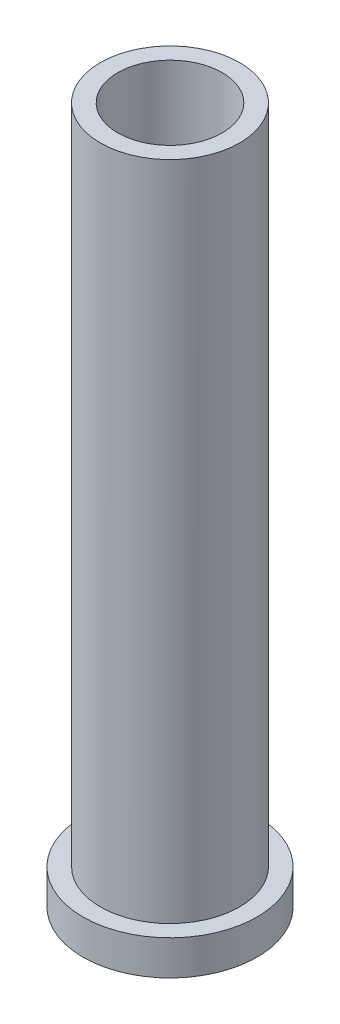
from build123d import *

# Parameters (mm, degrees)
SKETCH1_R           = 4
BOSS_EXTRUDE1_DEPTH = 38
SKETCH2_R           = 5
BOSS_EXTRUDE2_DEPTH = 2
SKETCH3_R           = 3
CUT_EXTRUDE1_DEPTH  = 41


with BuildPart() as part:
    # Sketch1 → Boss-Extrude1 (new body)
    with BuildSketch(Plane(origin=(0, 0, 0), x_dir=(1, 0, 0), z_dir=(0, 1, 0))):
        Circle(SKETCH1_R)
    extrude(amount=BOSS_EXTRUDE1_DEPTH)

    # Sketch2 → Boss-Extrude2 (add)
    with BuildSketch(Plane.XZ):
        Circle(SKETCH2_R)
    extrude(amount=BOSS_EXTRUDE2_DEPTH)

    # Sketch3 → Cut-Extrude1 (cut)
    with BuildSketch(Plane(origin=(0, 38, 0), x_dir=(1, 0, 0), z_dir=(0, 1, 0))):
        Circle(SKETCH3_R)
    extrude(amount=-CUT_EXTRUDE1_DEPTH, mode=Mode.SUBTRACT)


solid = part.part
